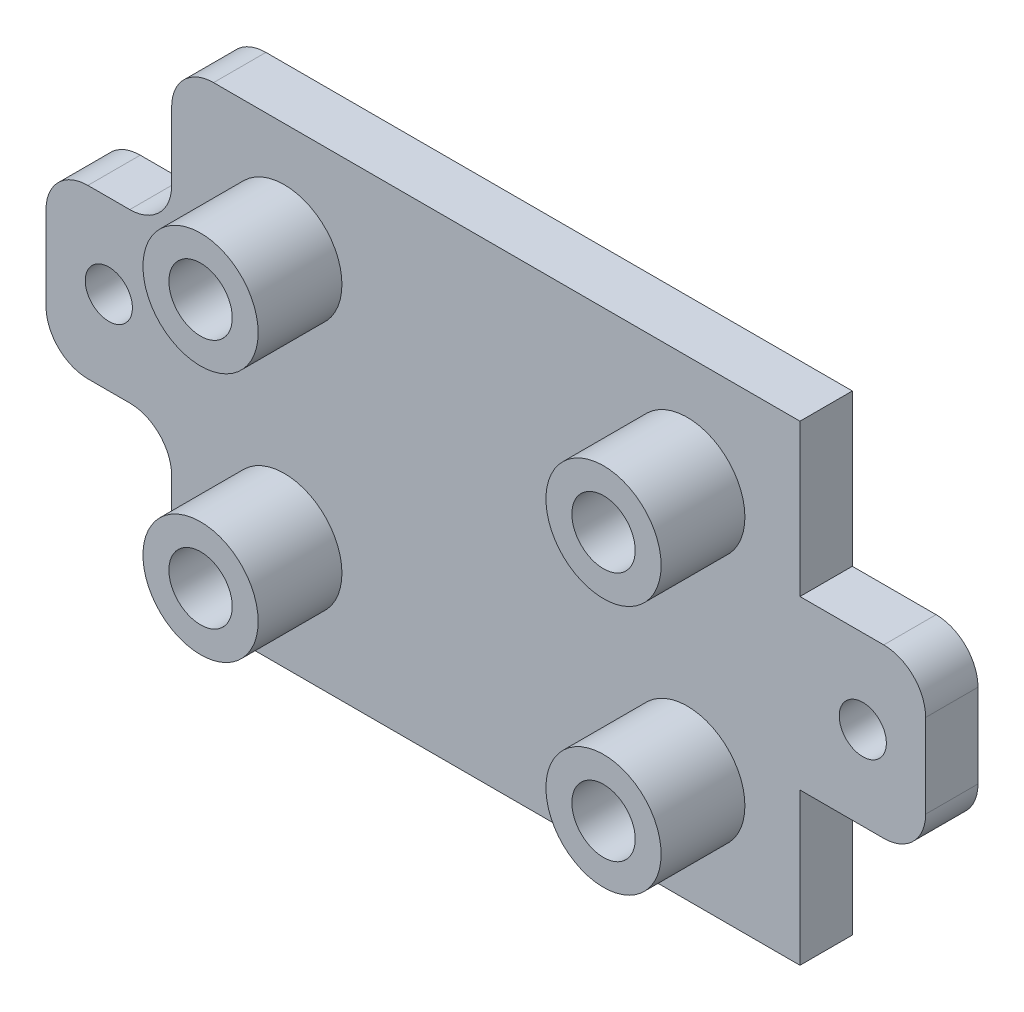
from build123d import *

# Parameters (mm, degrees)
SKETCH1_W            = 60
SKETCH1_H            = 45
BOSS_EXTRUDE1_DEPTH  = 5
SKETCH3_R            = 5.5
SKETCH3_R_2          = 3.025
BOSS_EXTRUDE2_DEPTH  = 8
SKETCH4_W            = 12
SKETCH4_H            = 16
SKETCH4_R            = 2.55
BOSS_EXTRUDE3_DEPTH  = 5
FILLET1_R            = 4
M4_CLEARANCE_HOLE1_D = 4.5
MIRROR1_OUTLINE_R    = 2.25
MIRROR1_DEPTH        = 5


# Read off the part's stored shape, not the designer's step: Mirror1
with BuildPart() as part:
    # Sketch1 → Boss-Extrude1 (new body)
    with BuildSketch(Plane.XY):
        Rectangle(SKETCH1_W, SKETCH1_H)
    extrude(amount=BOSS_EXTRUDE1_DEPTH)

    # Sketch3 → Boss-Extrude2 (add)
    # profile 1 of 4: a face of its own
    with BuildSketch(Plane.XY.offset(5)):
        with Locations((-19.2405, 11.938)):
            Circle(SKETCH3_R)
        with Locations((-19.2405, 11.938)):
            Circle(SKETCH3_R_2, mode=Mode.SUBTRACT)
    # profile 2 of 4: a face of its own
    with BuildSketch(Plane.XY.offset(5)):
        with Locations((-19.2405, -11.938)):
            Circle(SKETCH3_R)
        with Locations((-19.2405, -11.938)):
            Circle(SKETCH3_R_2, mode=Mode.SUBTRACT)
    # profile 3 of 4: a face of its own
    with BuildSketch(Plane.XY.offset(5)):
        with Locations((19.2405, 11.938)):
            Circle(SKETCH3_R)
        with Locations((19.2405, 11.938)):
            Circle(SKETCH3_R_2, mode=Mode.SUBTRACT)
    # profile 4 of 4: a face of its own
    with BuildSketch(Plane.XY.offset(5)):
        with Locations((19.2405, -11.938)):
            Circle(SKETCH3_R)
        with Locations((19.2405, -11.938)):
            Circle(SKETCH3_R_2, mode=Mode.SUBTRACT)
    extrude(amount=BOSS_EXTRUDE2_DEPTH)

    # Sketch4 → Boss-Extrude3 (add)
    # profile 1 of 2: a face of its own
    with BuildSketch(Plane.XY.offset(5)):
        with Locations((-36, 0)):
            Rectangle(SKETCH4_W, SKETCH4_H)
        with Locations((-36, 0)):
            Circle(SKETCH4_R, mode=Mode.SUBTRACT)
    # profile 2 of 2: a face of its own
    with BuildSketch(Plane.XY.offset(5)):
        with Locations((-36, 0)):
            Circle(SKETCH4_R)
    extrude(amount=-BOSS_EXTRUDE3_DEPTH)

    # Fillet1
    fillet1_edges = [part.edges().sort_by_distance(p)[0] for p in [
        (-42, -8, 2.5),
        (-42, 8, 2.5),
        (-30, 8, 2.5),
        (-30, -8, 2.5),
        (-30, 22.5, 2.5),
        (-30, -22.5, 2.5),
    ]]
    fillet(fillet1_edges, radius=FILLET1_R)

    # M4 Clearance Hole1 (through all)
    with Locations(Plane.XY.offset(5)):
        with Locations((-36, 0)):
            Hole(M4_CLEARANCE_HOLE1_D / 2)

    # Mirror1 outline → Mirror1 (add)
    with BuildSketch(Plane.XY):
        with BuildLine():
            ThreePointArc((42, 4), (40.828427125, 6.828427125), (38, 8))
            Line((38, 8), (30, 8))
            Line((30, 8), (30, -8))
            Line((30, -8), (38, -8))
            ThreePointArc((38, -8), (40.828427125, -6.828427125), (42, -4))
            Line((42, -4), (42, 4))
        make_face()
        with Locations((36, 0)):
            Circle(MIRROR1_OUTLINE_R, mode=Mode.SUBTRACT)
    extrude(amount=MIRROR1_DEPTH)


solid = part.part
